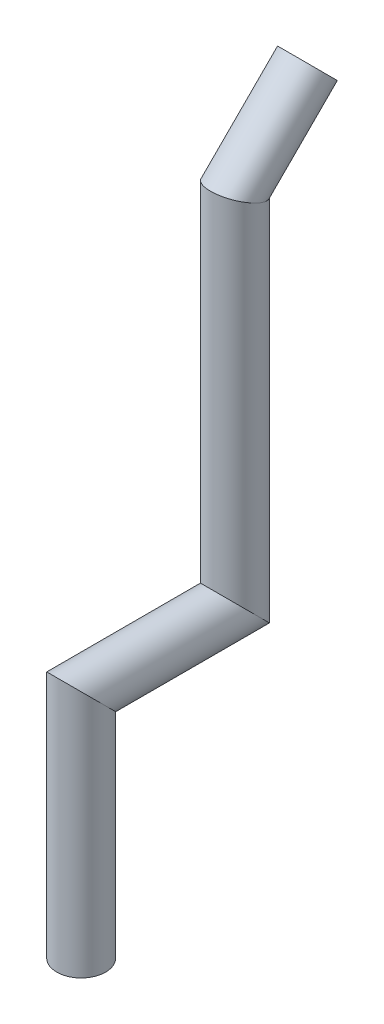
from build123d import *

# Parameters (mm, degrees)
SKETCH2_R          = 4.7625
SKETCH2_R_2        = 3.175
SKETCH11_W         = 4
SKETCH11_H         = 4.7625
CUT_EXTRUDE2_DEPTH = 8


with BuildPart() as part:
    # Sweep2: sweep along a path in Sketch4
    with BuildLine(Plane(origin=(0, 0, 0), x_dir=(0, 0, -1), z_dir=(1, 0, 0))) as sweep2_path:
        Line((8, 0), (8, 45))
        Line((8, 45), (38, 45))
        Line((38, 45), (38, 115))
        Line((38, 115), (52.142135624, 129.142135624))
    # Sketch2 → Sweep2 (sweep)
    with BuildSketch(Plane(origin=(0, 0, 0), x_dir=(1, 0, 0), z_dir=(0, 1, 0))):
        with Locations((0, 8)):
            Circle(SKETCH2_R)
        with Locations((0, 8)):
            Circle(SKETCH2_R_2, mode=Mode.SUBTRACT)
    sweep(path=sweep2_path.line, transition=Transition.RIGHT)

    # Sketch11 → Cut-Extrude2 (cut)
    with BuildSketch(Plane(origin=(0, 87.106601718, -87.106601718), x_dir=(1, 0, 0), z_dir=(0, 0.7071067811865487, -0.7071067811865465))):
        with Locations((0, -52.065972151)):
            Rectangle(SKETCH11_W, SKETCH11_H)
    extrude(amount=-CUT_EXTRUDE2_DEPTH, mode=Mode.SUBTRACT)


solid = part.part
